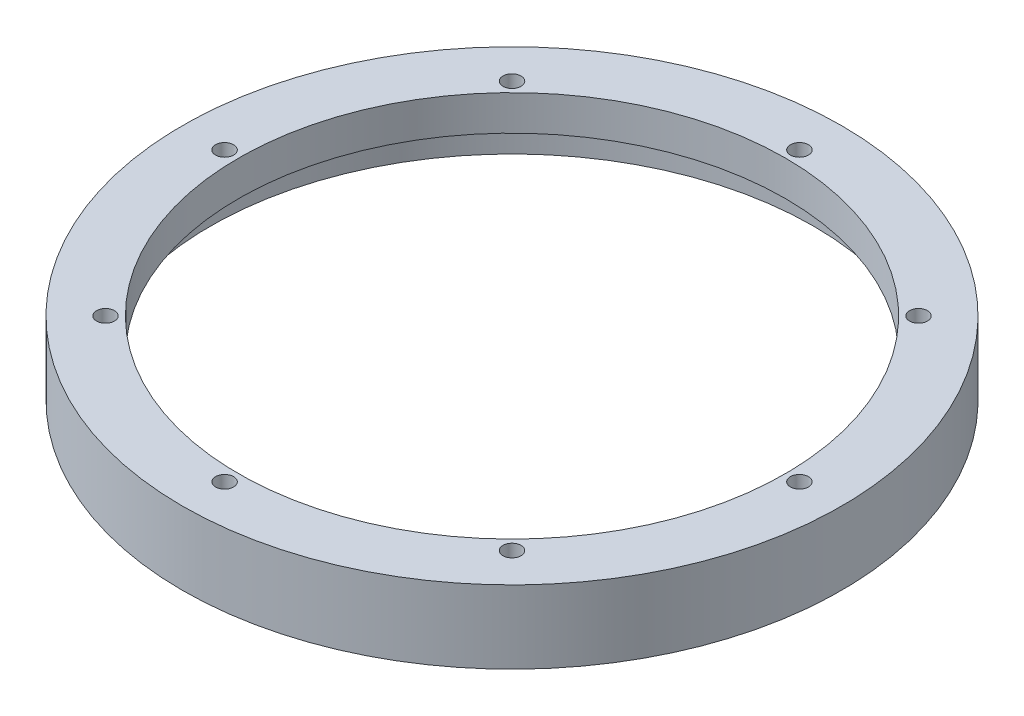
from build123d import *

# Parameters (mm, degrees)
CIRPATTERN1_COUNT = 8


with BuildPart() as part:
    # Sketch1 → Revolve1 (revolve)
    with BuildSketch(Plane.XY):
        Polygon((-49.4665, 0), (-59.6265, 0), (-59.6265, -13.208), (-54.5465, -13.208), (-54.5465, -6.35), (-49.4665, -6.35), align=None)
    revolve(axis=Axis((0, 0, 0), (0, 1, 0)))

    # Sketch3 → #4 Clearance Hole1 (revolve, cut)
    with BuildSketch(Plane(origin=(0, 0, -52.0065), x_dir=(0, 0, 1), z_dir=(1, 0, 0))):
        Polygon((0, 0), (0, 11.140574487), (1.63195, 10.16), (1.63195, 0), align=None)
    f_4_clearance_hole1 = revolve(axis=Axis((0, 6.35, -52.0065), (0, -1, 0)), mode=Mode.SUBTRACT)

    # CirPattern1: #4 Clearance Hole1 ×8 about axis
    cirpattern1_axis = Axis((0, 0, 0), (0, -1, 0))
    for i in range(1, CIRPATTERN1_COUNT):
        add(f_4_clearance_hole1.rotate(cirpattern1_axis, i * 360 / CIRPATTERN1_COUNT), mode=Mode.SUBTRACT)


solid = part.part
